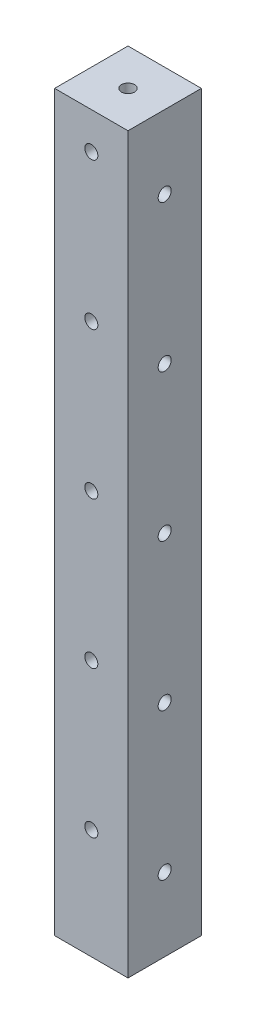
from build123d import *

# Parameters (mm, degrees)
SKETCH1_W                           = 12.7
SKETCH1_H                           = 12.7
BOSS_EXTRUDE1_DEPTH                 = 127
F_4_40_TAPPED_HOLE1_D               = 2.2606
F_4_40_TAPPED_HOLE1_DEPTH           = 7.6
F_4_40_TAPPED_HOLE1_TIP             = 0.679152758
F_4_40_TAPPED_HOLE1_ON_FACE_2_D     = 2.2606
F_4_40_TAPPED_HOLE1_ON_FACE_2_DEPTH = 7.6
F_4_40_TAPPED_HOLE1_ON_FACE_2_TIP   = 0.679152758
F_4_40_TAPPED_HOLE2_D               = 2.2606
LPATTERN1_COUNT                     = 5
LPATTERN1_PITCH                     = 25.4
F_4_40_TAPPED_HOLE3_OUTLINE_R       = 1.1303
F_4_40_TAPPED_HOLE3_DEPTH           = 12.7
LPATTERN2_COUNT                     = 5
LPATTERN2_PITCH                     = 25.4


# Read off the part's stored shape, not the designer's step: #4-40 Tapped Hole3
with BuildPart() as part:
    # Sketch1 → Boss-Extrude1 (new body)
    with BuildSketch(Plane(origin=(0, 0, 0), x_dir=(1, 0, 0), z_dir=(0, 1, 0))):
        with Locations((6.35, -6.35)):
            Rectangle(SKETCH1_W, SKETCH1_H)
    extrude(amount=BOSS_EXTRUDE1_DEPTH)

    # #4-40 Tapped Hole1
    with Locations(Plane(origin=(6.35, 127, 6.35), x_dir=(0, 0, 1), z_dir=(0, 1, 0))):
        with Locations((0, 0)):
            Hole(F_4_40_TAPPED_HOLE1_D / 2, depth=F_4_40_TAPPED_HOLE1_DEPTH)
            with Locations((0, 0, -(F_4_40_TAPPED_HOLE1_DEPTH + F_4_40_TAPPED_HOLE1_TIP / 2))):  # 118° drill point
                Cone(0, F_4_40_TAPPED_HOLE1_D / 2, F_4_40_TAPPED_HOLE1_TIP, mode=Mode.SUBTRACT)

    # #4-40 Tapped Hole1 on face 2
    with Locations(Plane(origin=(6.35, 0, 6.35), x_dir=(0, 0, -1), z_dir=(0, -1, 0))):
        with Locations((0, 0)):
            Hole(F_4_40_TAPPED_HOLE1_ON_FACE_2_D / 2, depth=F_4_40_TAPPED_HOLE1_ON_FACE_2_DEPTH)
            with Locations((0, 0, -(F_4_40_TAPPED_HOLE1_ON_FACE_2_DEPTH + F_4_40_TAPPED_HOLE1_ON_FACE_2_TIP / 2))):  # 118° drill point
                Cone(0, F_4_40_TAPPED_HOLE1_ON_FACE_2_D / 2, F_4_40_TAPPED_HOLE1_ON_FACE_2_TIP, mode=Mode.SUBTRACT)

    # #4-40 Tapped Hole2 (through all)
    with Locations(Plane(origin=(6.35, 120.65, 0), x_dir=(-1, 0, 0), z_dir=(0, 0, -1))):
        with Locations((0, 0)):
            f_4_40_tapped_hole2 = Hole(F_4_40_TAPPED_HOLE2_D / 2)

    # LPattern1: #4-40 Tapped Hole2 ×5
    with Locations(*[(0, -i * LPATTERN1_PITCH, 0) for i in range(1, LPATTERN1_COUNT)]):
        add(f_4_40_tapped_hole2, mode=Mode.SUBTRACT)

    # #4-40 Tapped Hole3 outline → #4-40 Tapped Hole3 (cut)
    with BuildSketch(Plane.YZ):
        with Locations((114.3, 6.35)):
            Circle(F_4_40_TAPPED_HOLE3_OUTLINE_R)
    f_4_40_tapped_hole3 = extrude(amount=F_4_40_TAPPED_HOLE3_DEPTH, mode=Mode.SUBTRACT)

    # LPattern2: #4-40 Tapped Hole3 ×5
    with Locations(*[(0, -i * LPATTERN2_PITCH, 0) for i in range(1, LPATTERN2_COUNT)]):
        add(f_4_40_tapped_hole3, mode=Mode.SUBTRACT)


solid = part.part
